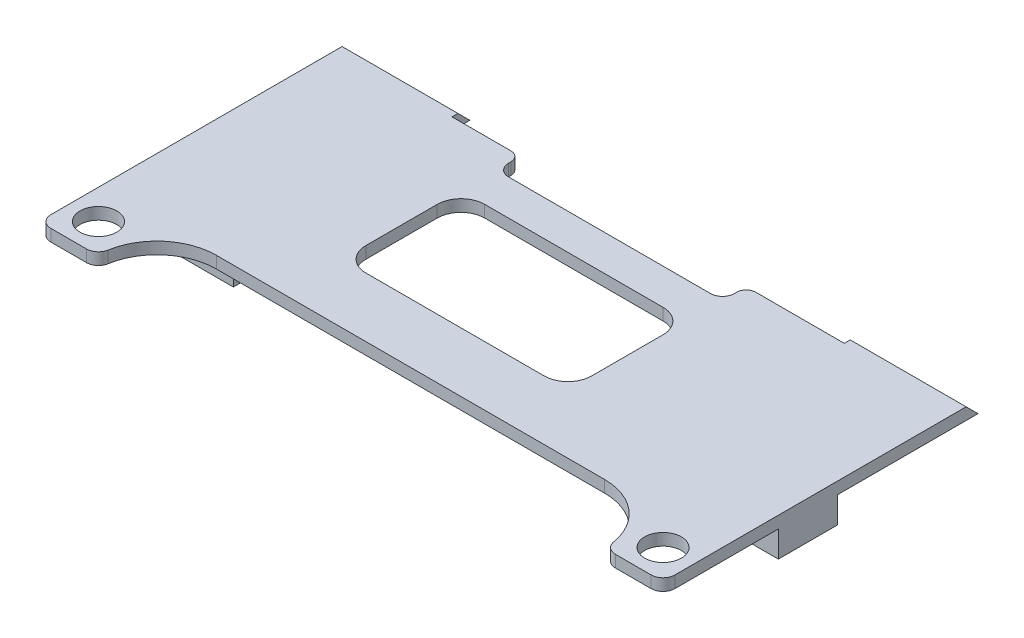
from build123d import *

# Parameters (mm, degrees)
SKETCH1_R           = 1.55
BOSS_EXTRUDE1_DEPTH = 1
CHAMFER1_SIZE       = 1.5
SKETCH5_W           = 9.75
SKETCH5_H           = 17.3
SKETCH5_H_2         = 5
BOSS_EXTRUDE2_DEPTH = 2.2
FILLET2_R           = 5


with BuildPart() as part:
    # Sketch1 → Boss-Extrude1 (new body)
    with BuildSketch(Plane(origin=(0, 0, 0), x_dir=(1, 0, 0), z_dir=(0, 1, 0))):
        with BuildLine():
            Line((-11.55, 10), (-16.5, 10))
            Line((-16.5, 10), (-16.5, 12))
            Line((-16.5, 12), (-26.25, 12))
            Line((-26.25, 12), (-26.25, -14))
            ThreePointArc((-26.25, -14), (-25.957106781, -14.707106781), (-25.25, -15))
            Line((-25.25, -15), (-22.25, -15))
            ThreePointArc((-22.25, -15), (-21.542893219, -14.707106781), (-21.25, -14))
            Line((-21.25, -14), (-21.25, -10))
            Line((-21.25, -10), (21.25, -10))
            Line((21.25, -10), (21.25, -14))
            ThreePointArc((21.25, -14), (21.542893219, -14.707106781), (22.25, -15))
            Line((22.25, -15), (25.25, -15))
            ThreePointArc((25.25, -15), (25.957106781, -14.707106781), (26.25, -14))
            Line((26.25, -14), (26.25, 12))
            Line((26.25, 12), (16.5, 12))
            Line((16.5, 12), (16.5, 10))
            Line((16.5, 10), (9.05, 10))
            ThreePointArc((9.05, 10), (8.484314575, 9.765685425), (8.25, 9.2))
            Line((8.25, 9.2), (8.25, 9))
            ThreePointArc((8.25, 9), (7.957106781, 8.292893219), (7.25, 8))
            Line((7.25, 8), (-9.75, 8))
            ThreePointArc((-9.75, 8), (-10.457106781, 8.292893219), (-10.75, 9))
            Line((-10.75, 9), (-10.75, 9.2))
            ThreePointArc((-10.75, 9.2), (-10.984314575, 9.765685425), (-11.55, 10))
        make_face()
        with BuildLine():
            Line((6.25, -5), (-8.75, -5))
            ThreePointArc((-8.75, -5), (-10.164213562, -4.414213562), (-10.75, -3))
            Line((-10.75, -3), (-10.75, 3))
            ThreePointArc((-10.75, 3), (-10.164213562, 4.414213562), (-8.75, 5))
            Line((-8.75, 5), (6.25, 5))
            ThreePointArc((6.25, 5), (7.664213562, 4.414213562), (8.25, 3))
            Line((8.25, 3), (8.25, -3))
            ThreePointArc((8.25, -3), (7.664213562, -4.414213562), (6.25, -5))
        make_face(mode=Mode.SUBTRACT)
        with Locations(Location((-23.75, -12.5, 0), (0, 0, 270))):
            Circle(SKETCH1_R, mode=Mode.SUBTRACT)
        with Locations(Location((23.75, -12.5, 0), (0, 0, 270))):
            Circle(SKETCH1_R, mode=Mode.SUBTRACT)
    extrude(amount=BOSS_EXTRUDE1_DEPTH)

    # Chamfer1
    # the kernel refuses this chamfer: 1.5 mm, written as the material it takes off along each edge
    with BuildSketch(Plane(origin=(-12.642475518, 1, -12), x_dir=(0, -0.9996219169112968, -0.027495876610586778), z_dir=(-1, 0, 0)), Plane(origin=(30.107524482, 1, -12), x_dir=(0, -0.9996219169112968, -0.027495876610586778), z_dir=(-1, 0, 0))) as chamfer1_piece_1:
        Polygon((CHAMFER1_SIZE * 0.999621916911, CHAMFER1_SIZE * 0.0274958766106), (-CHAMFER1_SIZE * 0.0274958766106, CHAMFER1_SIZE * 0.999621916911), (0, 0), align=None)
    extrude(amount=17.465048964, mode=Mode.SUBTRACT)

    # Sketch5 → Boss-Extrude2 (add)
    with BuildSketch(Plane.XZ):
        with Locations((-21.375, -0.25)):
            Rectangle(SKETCH5_W, SKETCH5_H)
        with Locations((21.375, 2.8)):
            Rectangle(SKETCH5_W, SKETCH5_H_2)
    extrude(amount=BOSS_EXTRUDE2_DEPTH)

    # Fillet2
    fillet2_edges = [part.edges().sort_by_distance(p)[0] for p in [
        (21.25, 0.5, 10),
        (-21.25, 0.5, 10),
    ]]
    fillet(fillet2_edges, radius=FILLET2_R)


solid = part.part
